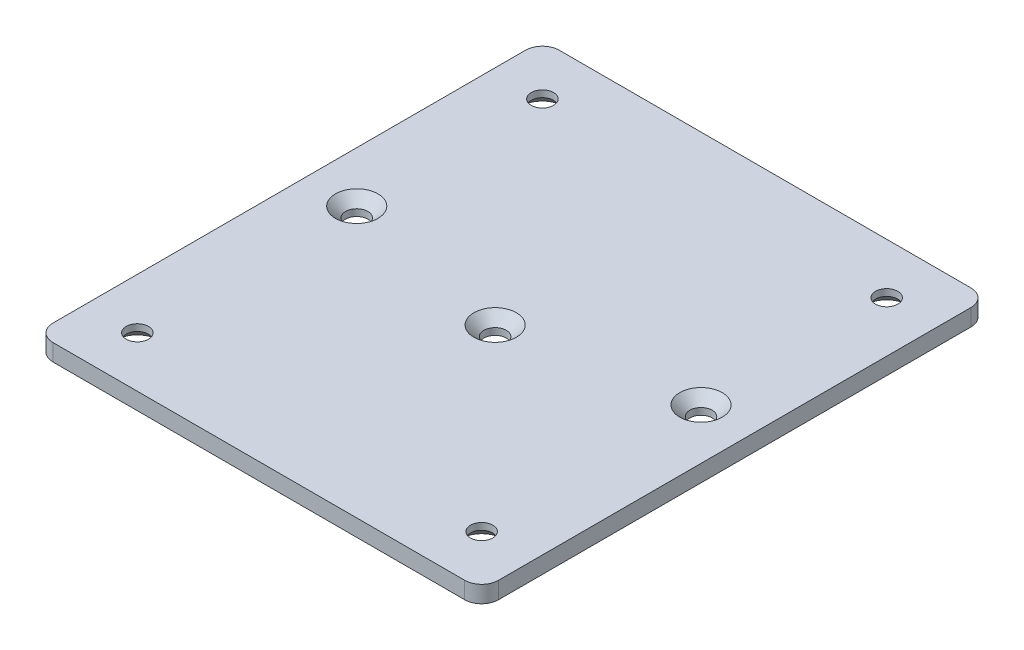
from build123d import *

# Parameters (mm, degrees)
SKETCH1_W                                       = 132
SKETCH1_H                                       = 150
BOSS_EXTRUDE1_DEPTH                             = 5
CSK_FOR_M6_FLAT_HEAD_MACHINE_SCREW1_D           = 6.6
CSK_FOR_M6_FLAT_HEAD_MACHINE_SCREW1_DEPTH       = 10
CSK_FOR_M6_FLAT_HEAD_MACHINE_SCREW1_CSINK_D     = 12.6
CSK_FOR_M6_FLAT_HEAD_MACHINE_SCREW1_CSINK_ANGLE = 90
CSK_FOR_M6_FLAT_HEAD_MACHINE_SCREW1_TIP         = 1.982840043
CSK_FOR_M6_FLAT_HEAD_MACHINE_SCREW2_D           = 6.6
CSK_FOR_M6_FLAT_HEAD_MACHINE_SCREW2_DEPTH       = 10
CSK_FOR_M6_FLAT_HEAD_MACHINE_SCREW2_CSINK_D     = 12.6
CSK_FOR_M6_FLAT_HEAD_MACHINE_SCREW2_CSINK_ANGLE = 90
CSK_FOR_M6_FLAT_HEAD_MACHINE_SCREW2_TIP         = 1.982840043
FILLET1_R                                       = 5


with BuildPart() as part:
    # Sketch1 → Boss-Extrude1 (new body)
    with BuildSketch(Plane(origin=(0, 0, 0), x_dir=(1, 0, 0), z_dir=(0, 1, 0))):
        with Locations((66, 75)):
            Rectangle(SKETCH1_W, SKETCH1_H)
    extrude(amount=BOSS_EXTRUDE1_DEPTH)

    # CSK for M6 Flat Head Machine Screw1
    with Locations(Plane(origin=(0, 5, 0), x_dir=(1, 0, 0), z_dir=(0, 1, 0))):
        with Locations((15, 80), (66, 70), (117, 80)):
            CounterSinkHole(CSK_FOR_M6_FLAT_HEAD_MACHINE_SCREW1_D / 2, CSK_FOR_M6_FLAT_HEAD_MACHINE_SCREW1_CSINK_D / 2, depth=CSK_FOR_M6_FLAT_HEAD_MACHINE_SCREW1_DEPTH, counter_sink_angle=CSK_FOR_M6_FLAT_HEAD_MACHINE_SCREW1_CSINK_ANGLE)
            with Locations((0, 0, -(CSK_FOR_M6_FLAT_HEAD_MACHINE_SCREW1_DEPTH + CSK_FOR_M6_FLAT_HEAD_MACHINE_SCREW1_TIP / 2))):  # 118° drill point
                Cone(0, CSK_FOR_M6_FLAT_HEAD_MACHINE_SCREW1_D / 2, CSK_FOR_M6_FLAT_HEAD_MACHINE_SCREW1_TIP, mode=Mode.SUBTRACT)

    # CSK for M6 Flat Head Machine Screw2
    with Locations(Plane(origin=(0, 0, 0), x_dir=(-1, 0, 0), z_dir=(0, -1, 0))):
        with Locations((-15, 15), (-117, 15), (-117, 135), (-15, 135)):
            CounterSinkHole(CSK_FOR_M6_FLAT_HEAD_MACHINE_SCREW2_D / 2, CSK_FOR_M6_FLAT_HEAD_MACHINE_SCREW2_CSINK_D / 2, depth=CSK_FOR_M6_FLAT_HEAD_MACHINE_SCREW2_DEPTH, counter_sink_angle=CSK_FOR_M6_FLAT_HEAD_MACHINE_SCREW2_CSINK_ANGLE)
            with Locations((0, 0, -(CSK_FOR_M6_FLAT_HEAD_MACHINE_SCREW2_DEPTH + CSK_FOR_M6_FLAT_HEAD_MACHINE_SCREW2_TIP / 2))):  # 118° drill point
                Cone(0, CSK_FOR_M6_FLAT_HEAD_MACHINE_SCREW2_D / 2, CSK_FOR_M6_FLAT_HEAD_MACHINE_SCREW2_TIP, mode=Mode.SUBTRACT)

    # Fillet1
    fillet1_edges = [part.edges().sort_by_distance(p)[0] for p in [
        (132, 2.5, -150),
        (132, 2.5, 0),
        (0, 2.5, 0),
        (0, 2.5, -150),
    ]]
    fillet(fillet1_edges, radius=FILLET1_R)


solid = part.part
